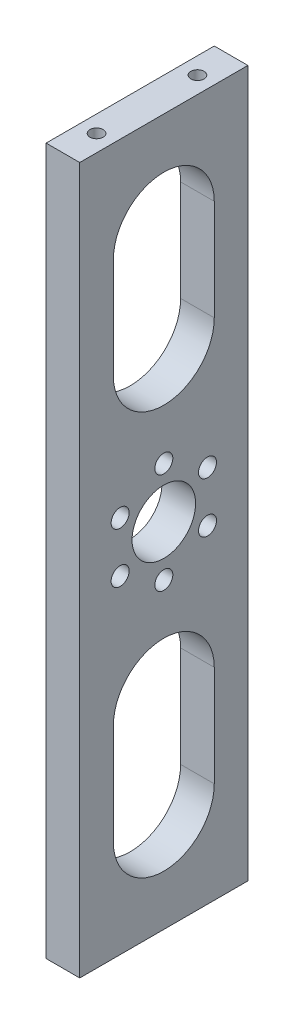
from build123d import *

# Parameters (mm, degrees)
SKETCH1_W                      = 31.75
SKETCH1_H                      = 133.35
BOSS_EXTRUDE1_DEPTH            = 3.175
M3X0_5_TAPPED_HOLE1_AT_2_COUNT = 2
M3X0_5_TAPPED_HOLE1_AT_2_PITCH = 19.05
F_12_0MM_DOWEL_HOLE1_D         = 12
CBORE_FOR_M3_SHCS1_D           = 3.4
CBORE_FOR_M3_SHCS1_DEPTH       = 11.678536948
CBORE_FOR_M3_SHCS1_CBORE_D     = 4.5
CBORE_FOR_M3_SHCS1_CBORE_DEPTH = 2
CBORE_FOR_M3_SHCS1_TIP         = 1.021463052
CUT_EXTRUDE1_DEPTH             = 69.832359759


with BuildPart() as part:
    # Sketch1 → Boss-Extrude1 (new, symmetric)
    with BuildSketch(Plane(origin=(0, 0, 0), x_dir=(0, 0, -1), z_dir=(1, 0, 0))):
        Rectangle(SKETCH1_W, SKETCH1_H)
    extrude(amount=BOSS_EXTRUDE1_DEPTH, both=True)

    # Sketch5 → M3x0.5 Tapped Hole1 (revolve, cut)
    with BuildSketch(Plane(origin=(0, 66.675, -9.525), x_dir=(0, 0, 1), z_dir=(1, 0, 0))):
        Polygon((0, 0), (0, 13.451075774), (1.25, 12.7), (1.25, 0), align=None)
    m3x0_5_tapped_hole1 = revolve(axis=Axis((0, 73.025, -9.525), (0, -1, 0)), mode=Mode.SUBTRACT)

    # M3x0.5 Tapped Hole1 at 2: M3x0.5 Tapped Hole1 ×2
    with Locations(*[(0, 0, i * M3X0_5_TAPPED_HOLE1_AT_2_PITCH) for i in range(1, M3X0_5_TAPPED_HOLE1_AT_2_COUNT)]):
        add(m3x0_5_tapped_hole1, mode=Mode.SUBTRACT)

    # Mirror1: M3x0.5 Tapped Hole1 across plane
    add(m3x0_5_tapped_hole1.mirror(Plane.ZX), mode=Mode.SUBTRACT)

    # Mirror1 copy 1 sketch → Mirror1 copy 1 (revolve, cut)
    with BuildSketch(Plane(origin=(0, -66.675, 9.525), x_dir=(0, 0, 1), z_dir=(1, 0, 0))):
        Polygon((0, 0), (0, -13.451075774), (1.25, -12.7), (1.25, 0), align=None)
    revolve(axis=Axis((0, -73.025, 9.525), (0, -1, 0)), mode=Mode.SUBTRACT)

    # Ø12.0mm Dowel Hole1 (through all)
    with Locations(Plane.ZY.offset(3.175)):
        with Locations((0, 0)):
            Hole(F_12_0MM_DOWEL_HOLE1_D / 2)

    # CBORE for M3 SHCS1
    with Locations(Plane.ZY.offset(3.175)):
        with Locations((8.248891971, -4.7625), (8.248891971, 4.7625), (0, 9.525), (-8.248891971, 4.7625), (-8.248891971, -4.7625), (0, -9.525)):
            CounterBoreHole(CBORE_FOR_M3_SHCS1_D / 2, CBORE_FOR_M3_SHCS1_CBORE_D / 2, CBORE_FOR_M3_SHCS1_CBORE_DEPTH, depth=CBORE_FOR_M3_SHCS1_DEPTH)
            with Locations((0, 0, -(CBORE_FOR_M3_SHCS1_DEPTH + CBORE_FOR_M3_SHCS1_TIP / 2))):  # 118° drill point
                Cone(0, CBORE_FOR_M3_SHCS1_D / 2, CBORE_FOR_M3_SHCS1_TIP, mode=Mode.SUBTRACT)

    # Sketch12 → Cut-Extrude1 (cut, through all)
    with BuildSketch(Plane(origin=(3.175, 0, 0), x_dir=(0, 0, -1), z_dir=(1, 0, 0))):
        with BuildLine():
            Line((9.525, 28.575), (9.525, 47.625))
            ThreePointArc((9.525, 47.625), (0, 57.15), (-9.525, 47.625))
            Line((-9.525, 47.625), (-9.525, 28.575))
            ThreePointArc((-9.525, 28.575), (0, 19.05), (9.525, 28.575))
        make_face()
        with BuildLine():
            Line((9.525, -47.625), (9.525, -28.575))
            ThreePointArc((9.525, -28.575), (0, -19.05), (-9.525, -28.575))
            Line((-9.525, -28.575), (-9.525, -47.625))
            ThreePointArc((-9.525, -47.625), (0, -57.15), (9.525, -47.625))
        make_face()
    extrude(amount=-CUT_EXTRUDE1_DEPTH, mode=Mode.SUBTRACT)


solid = part.part
